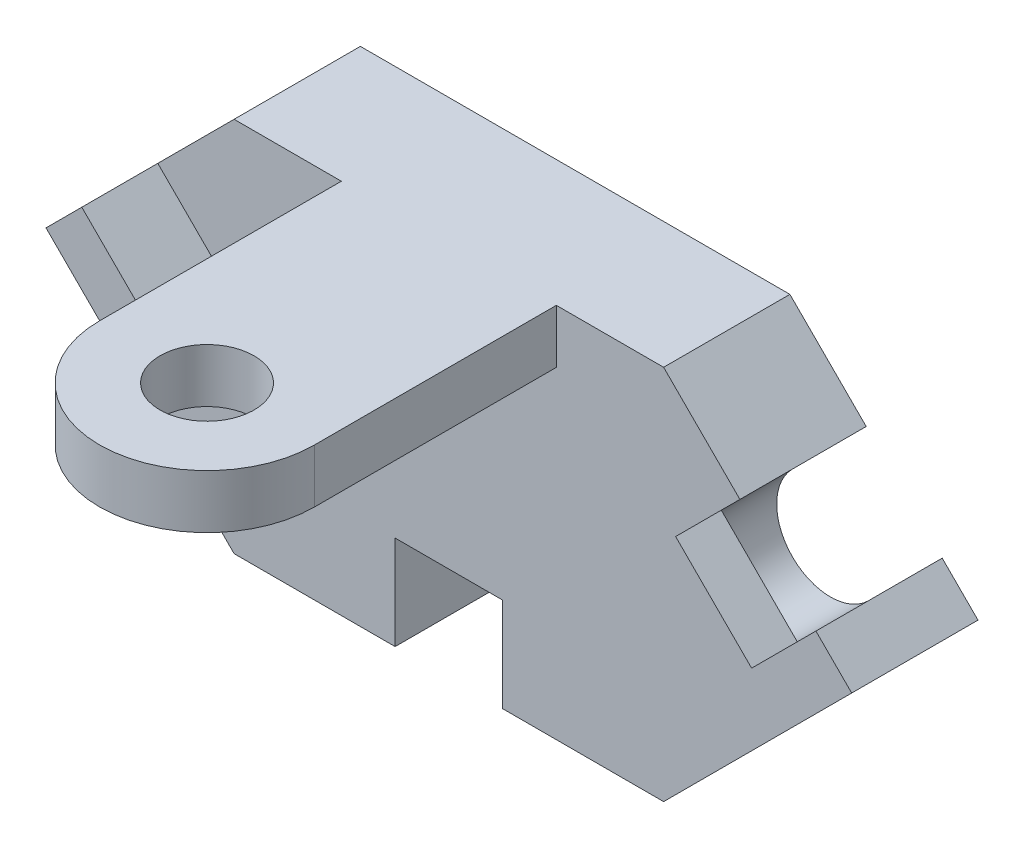
from build123d import *

# Parameters (mm, degrees)
RESSALTO_EXTRUS_O1_DEPTH = 3
RESSALTO_EXTRUS_O2_DEPTH = 1.7
ESBO_O3_R                = 1.75
RESSALTO_EXTRUS_O3_DEPTH = 2


with BuildPart() as part:
    # Esboço1 → Ressalto-extrusão1 (new body)
    with BuildSketch(Plane.XY):
        with BuildLine():
            Line((-7.992880918, 7), (-10.832226897, 4.160654021))
            Line((-10.832226897, 4.160654021), (-8.085786438, 1.414213562))
            ThreePointArc((-8.085786438, 1.414213562), (-8.085786438, -1.414213562), (-10.914213562, -1.414213562))
            Line((-10.914213562, -1.414213562), (-13.660654021, 1.332226897))
            Line((-13.660654021, 1.332226897), (-14.992880918, 0))
            Line((-14.992880918, 0), (-7.992880918, -7))
            Line((-7.992880918, -7), (-2, -7))
            Line((-2, -7), (-2, -3))
            ThreePointArc((-2, -3), (0, -1), (2, -3))
            Line((2, -3), (2, -7))
            Line((2, -7), (7.992880918, -7))
            Line((7.992880918, -7), (14.992880918, 0))
            Line((14.992880918, 0), (13.660654021, 1.332226897))
            Line((13.660654021, 1.332226897), (10.914213562, -1.414213562))
            ThreePointArc((10.914213562, -1.414213562), (8.085786438, -1.414213562), (8.085786438, 1.414213562))
            Line((8.085786438, 1.414213562), (10.832226897, 4.160654021))
            Line((10.832226897, 4.160654021), (7.992880918, 7))
            Line((7.992880918, 7), (-7.992880918, 7))
        make_face()
    extrude(amount=RESSALTO_EXTRUS_O1_DEPTH)

    # Esboço2 → Ressalto-extrusão2 (add)
    with BuildSketch(Plane.XY.offset(3)):
        Polygon((-11.267766953, -1.060660172), (-8.439339828, 1.767766953), (-10.832226897, 4.160654021), (-7.992880918, 7), (7.992880918, 7), (10.832226897, 4.160654021), (8.439339828, 1.767766953), (11.267766953, -1.060660172), (13.660654021, 1.332226897), (14.992880918, 0), (7.992880918, -7), (2, -7), (2, -3.5), (-2, -3.5), (-2, -7), (-7.992880918, -7), (-14.992880918, 0), (-13.660654021, 1.332226897), align=None)
    extrude(amount=RESSALTO_EXTRUS_O2_DEPTH)

    # Esboço3 → Ressalto-extrusão3 (add)
    with BuildSketch(Plane(origin=(0, 7, 0), x_dir=(1, 0, 0), z_dir=(0, 1, 0))):
        with BuildLine():
            Line((4, -13.7), (4, -4.7))
            Line((4, -4.7), (-4, -4.7))
            Line((-4, -4.7), (-4, -13.7))
            ThreePointArc((-4, -13.7), (0, -17.7), (4, -13.7))
        make_face()
        with Locations((0, -13.7)):
            Circle(ESBO_O3_R, mode=Mode.SUBTRACT)
    extrude(amount=-RESSALTO_EXTRUS_O3_DEPTH)


solid = part.part
